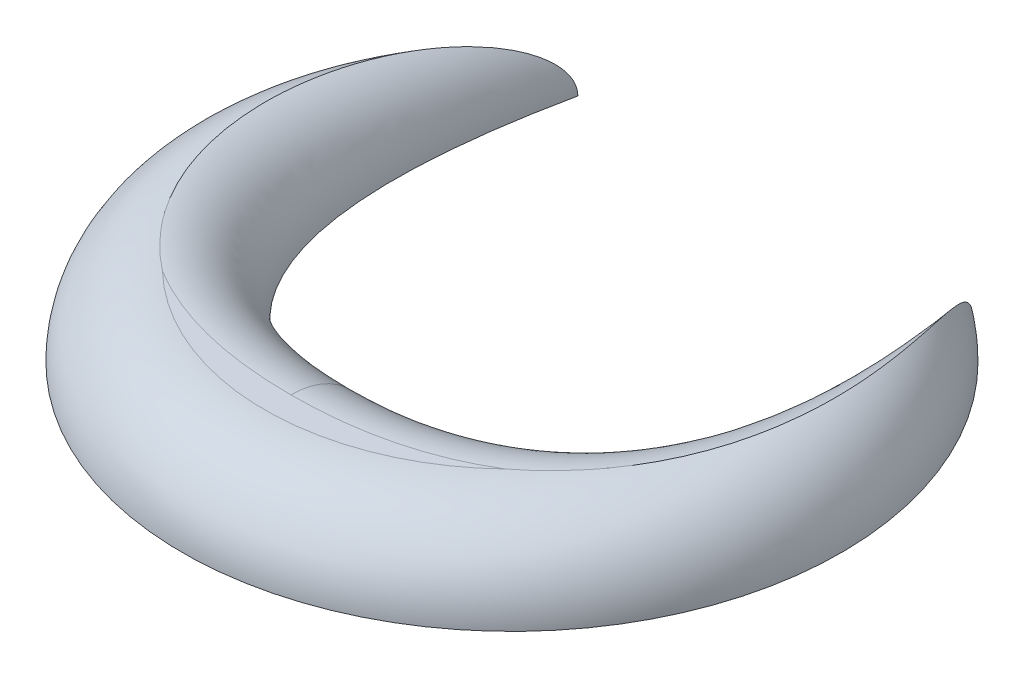
from build123d import *

# Parameters (mm, degrees)
BOSS_EXTRUDE1_DEPTH = 2.5
FILLET1_R           = 2.5


with BuildPart() as part:
    # Sketch1 → Boss-Extrude1 (new body)
    with BuildSketch(Plane(origin=(0, 0, 0), x_dir=(1, 0, 0), z_dir=(0, 1, 0))):
        with BuildLine():
            ThreePointArc((-6, 8), (0, -10), (6, 8))
            add(Edge.make_bspline(
                [(6, 8), (8.563253163, -4.208102808), (0, -4.208102808)],
                knots=[0, 0, 0, 1, 1, 1], degree=2))
            add(Edge.make_bspline(
                [(-6, 8), (-8.563253163, -4.208102808), (0, -4.208102808)],
                knots=[0, 0, 0, 1, 1, 1], degree=2))
        make_face()
    extrude(amount=BOSS_EXTRUDE1_DEPTH)

    # Fillet1
    fillet1_edges = [part.edges().sort_by_distance(p)[0] for p in [
        (0, 2.5, 10),
        (5.781626582, 2.5, 1.156077106),
        (-5.781626582, 2.5, 1.156077106),
    ]]
    fillet(fillet1_edges, radius=FILLET1_R - 0.0001)  # a hair under: the kernel refuses the full size


solid = part.part
